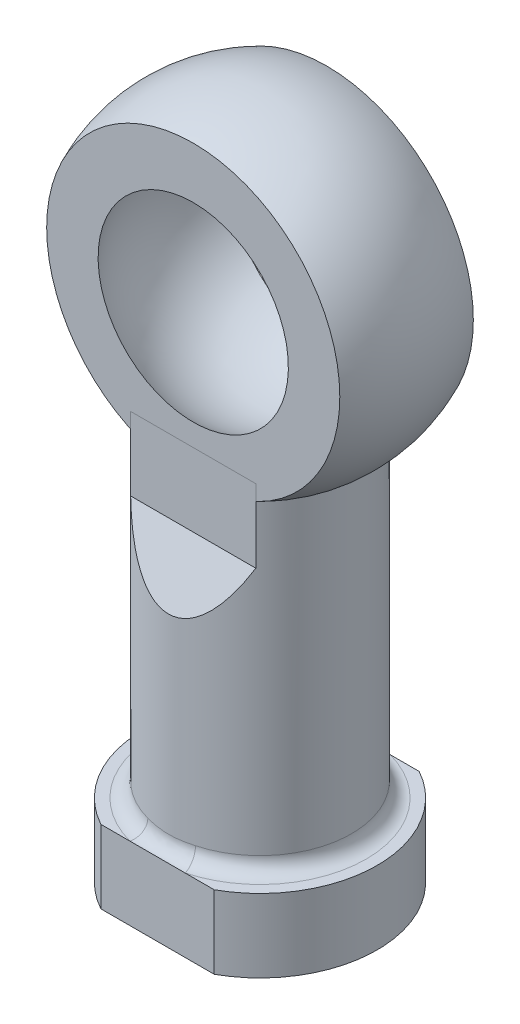
from build123d import *

# Parameters (mm, degrees)
EXTRUDERODHOLE_DEPTH      = 3
EXTRUDERODHOLE_DEPTH_BACK = 25
SKETCH5_R                 = 6.25
SKETCH5_R_2               = 3.4
SKETCH7_R                 = 3.4
BOSS_EXTRUDE1_DEPTH       = 5
FILLET1_R                 = 1
CUT_EXTRUDE1_DEPTH        = 39.28837955
CUT_EXTRUDE1_DEPTH_BACK   = 39.28837955


with BuildPart() as part:
    # Sketch3 → Revolve2 (revolve)
    with BuildSketch(Plane(origin=(0, 0, 0), x_dir=(0, 0, -1), z_dir=(1, 0, 0))):
        with BuildLine():
            Line((-4.56, 10.01031468), (-4.56, 0))
            Line((-4.56, 0), (4.56, 0))
            Line((4.56, 0), (4.56, 10.01031468))
            ThreePointArc((4.56, 10.01031468), (0, 11), (-4.56, 10.01031468))
        make_face()
    revolve(axis=Axis((0, 0, 8.146649187), (0, 0, -1)))

    # Sketch2 → Cut-Revolve2 (revolve, cut)
    with BuildSketch(Plane(origin=(0, 0, 0), x_dir=(0, 0, -1), z_dir=(1, 0, 0))):
        with BuildLine():
            Line((0, 7.938), (0, -7.938))
            ThreePointArc((0, -7.938), (7.938, 0), (0, 7.938))
        make_face()
    revolve(axis=Axis((0, 15.474361319, 0), (0, -1, 0)), mode=Mode.SUBTRACT)


with BuildPart() as body_2:
    # Sketch5 → ExtrudeRodHole (new, two sides: drawn at the far end of the back side and taken through both)
    with BuildSketch(Plane(origin=(0, -11, 0), x_dir=(-1, 0, 0), z_dir=(0, 1, 0)).offset(-EXTRUDERODHOLE_DEPTH_BACK)):
        Circle(SKETCH5_R)
        Circle(SKETCH5_R_2, mode=Mode.SUBTRACT)
    extrude(amount=EXTRUDERODHOLE_DEPTH + EXTRUDERODHOLE_DEPTH_BACK)

    # Sketch7 → Boss-Extrude1 (add)
    with BuildSketch(Plane.XZ.offset(36)):
        with BuildLine():
            Line((-3.872983346, 7), (3.872983346, 7))
            ThreePointArc((3.872983346, 7), (8, 0), (3.872983346, -7))
            Line((3.872983346, -7), (-3.872983346, -7))
            ThreePointArc((-3.872983346, -7), (-8, 0), (-3.872983346, 7))
        make_face()
        Circle(SKETCH7_R, mode=Mode.SUBTRACT)
    extrude(amount=-BOSS_EXTRUDE1_DEPTH)

    # Fillet1
    fillet1_edges = [body_2.edges().sort_by_distance(p)[0] for p in [
        (6.25, -31, 0),
    ]]
    fillet(fillet1_edges, radius=FILLET1_R)

    # Sketch8 → Cut-Extrude1 (cut, two sides: drawn at the far end of the back side and taken through both)
    with BuildSketch(Plane(origin=(0, 0, 0), x_dir=(0, 0, -1), z_dir=(1, 0, 0)).offset(-CUT_EXTRUDE1_DEPTH_BACK)):
        Polygon((-4.56, 0), (-4.56, -13), (-6.25, -17), (-14.338899791, -17), (-14.338899791, 16.981131473), (14.338899791, 16.981131473), (14.338899791, -17), (6.25, -17), (4.56, -13), (4.56, 0), (4.56, 14.718656898), (-4.56, 14.718656898), align=None)
    extrude(amount=CUT_EXTRUDE1_DEPTH + CUT_EXTRUDE1_DEPTH_BACK, mode=Mode.SUBTRACT)


solid = Compound([part.part, body_2.part])
